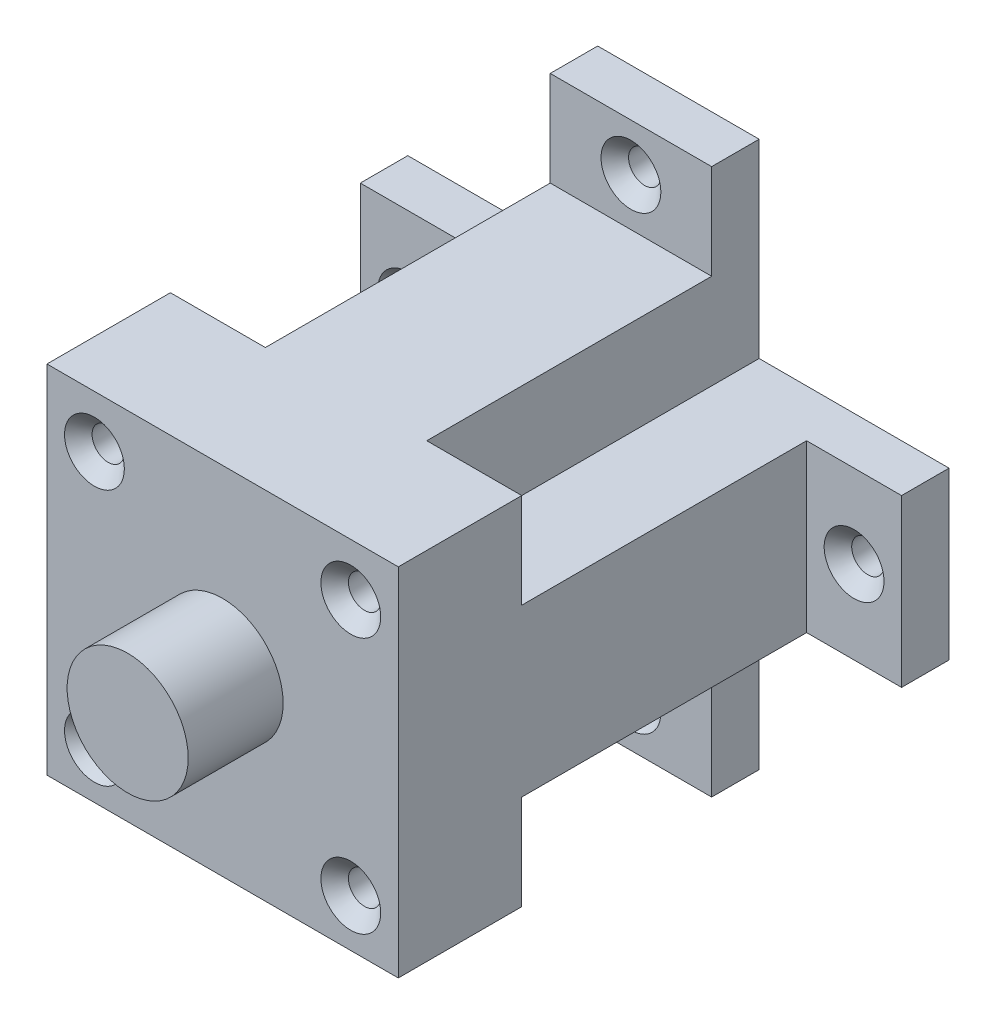
from build123d import *

# Parameters (mm, degrees)
ESQUISSE1_W                                       = 37
ESQUISSE1_H                                       = 37.5
BOSS_EXTRU_1_DEPTH                                = 48
ESQUISSE2_R                                       = 6.375
BOSS_EXTRU_2_DEPTH                                = 10
FRAISAGE_POUR_VIS_T_TE_FRAIS_E_BOMB_E_D           = 3.4
FRAISAGE_POUR_VIS_T_TE_FRAIS_E_BOMB_E_DEPTH       = 48
FRAISAGE_POUR_VIS_T_TE_FRAIS_E_BOMB_E_CSINK_D     = 6.3
FRAISAGE_POUR_VIS_T_TE_FRAIS_E_BOMB_E_CSINK_ANGLE = 90
FRAISAGE_POUR_VIS_T_TE_FRAIS_E_BOMB_E_TIP         = 1.021463052
ESQUISSE10_W                                      = 10
ESQUISSE10_H                                      = 10
ENL_V_MAT_EXTRU_1_DEPTH                           = 35
ESQUISSE11_W                                      = 17
ESQUISSE11_H                                      = 10
ESQUISSE11_W_2                                    = 10
ESQUISSE11_H_2                                    = 17.5
BOSS_EXTRU_5_DEPTH                                = 5
FRAISAGE_POUR_VIS_T_TE_FRAIS_E_BOM_2_D            = 3.4
FRAISAGE_POUR_VIS_T_TE_FRAIS_E_BOM_2_DEPTH        = 5
FRAISAGE_POUR_VIS_T_TE_FRAIS_E_BOM_2_CSINK_D      = 6.3
FRAISAGE_POUR_VIS_T_TE_FRAIS_E_BOM_2_CSINK_ANGLE  = 90
FRAISAGE_POUR_VIS_T_TE_FRAIS_E_BOM_2_TIP          = 1.021463052


with BuildPart() as part:
    # Esquisse1 → Boss.-Extru.1 (new body)
    with BuildSketch(Plane.XY):
        with Locations((18.5, 18.75)):
            Rectangle(ESQUISSE1_W, ESQUISSE1_H)
    extrude(amount=BOSS_EXTRU_1_DEPTH)

    # Esquisse2 → Boss.-Extru.2 (add)
    with BuildSketch(Plane.XY.offset(48)):
        with Locations((18.5, 19)):
            Circle(ESQUISSE2_R)
    extrude(amount=BOSS_EXTRU_2_DEPTH)

    # Fraisage pour vis _ t_te frais_e bomb_e
    with Locations(Plane.XY.offset(48)):
        with Locations((5, 32), (32, 32), (32, 5), (5, 5)):
            CounterSinkHole(FRAISAGE_POUR_VIS_T_TE_FRAIS_E_BOMB_E_D / 2, FRAISAGE_POUR_VIS_T_TE_FRAIS_E_BOMB_E_CSINK_D / 2, depth=FRAISAGE_POUR_VIS_T_TE_FRAIS_E_BOMB_E_DEPTH, counter_sink_angle=FRAISAGE_POUR_VIS_T_TE_FRAIS_E_BOMB_E_CSINK_ANGLE)
            with Locations((0, 0, -(FRAISAGE_POUR_VIS_T_TE_FRAIS_E_BOMB_E_DEPTH + FRAISAGE_POUR_VIS_T_TE_FRAIS_E_BOMB_E_TIP / 2))):  # 118° drill point
                Cone(0, FRAISAGE_POUR_VIS_T_TE_FRAIS_E_BOMB_E_D / 2, FRAISAGE_POUR_VIS_T_TE_FRAIS_E_BOMB_E_TIP, mode=Mode.SUBTRACT)

    # Esquisse10 → Enlèv. mat.-Extru.1 (cut)
    with BuildSketch(Plane(origin=(0, 0, 0), x_dir=(-1, 0, 0), z_dir=(0, 0, -1))):
        with Locations((-32, 5)):
            Rectangle(ESQUISSE10_W, ESQUISSE10_H)
        with Locations((-32, 32.5)):
            Rectangle(ESQUISSE10_W, ESQUISSE10_H)
        with Locations((-5, 32.5)):
            Rectangle(ESQUISSE10_W, ESQUISSE10_H)
        with Locations((-5, 5)):
            Rectangle(ESQUISSE10_W, ESQUISSE10_H)
    extrude(amount=-ENL_V_MAT_EXTRU_1_DEPTH, mode=Mode.SUBTRACT)

    # Esquisse11 → Boss.-Extru.5 (add)
    with BuildSketch(Plane(origin=(0, 0, 0), x_dir=(-1, 0, 0), z_dir=(0, 0, -1))):
        with Locations((-18.5, 42.5)):
            Rectangle(ESQUISSE11_W, ESQUISSE11_H)
        with Locations((-42, 18.75)):
            Rectangle(ESQUISSE11_W_2, ESQUISSE11_H_2)
        with Locations((5, 18.75)):
            Rectangle(ESQUISSE11_W_2, ESQUISSE11_H_2)
        with Locations((-18.5, -5)):
            Rectangle(ESQUISSE11_W, ESQUISSE11_H)
    extrude(amount=-BOSS_EXTRU_5_DEPTH)

    # Fraisage pour vis _ t_te frais_e bom 2
    with Locations(Plane.XY.offset(5)):
        with Locations((18.5, 42.5), (42, 18.75), (18.5, -5), (-5, 18.75)):
            CounterSinkHole(FRAISAGE_POUR_VIS_T_TE_FRAIS_E_BOM_2_D / 2, FRAISAGE_POUR_VIS_T_TE_FRAIS_E_BOM_2_CSINK_D / 2, depth=FRAISAGE_POUR_VIS_T_TE_FRAIS_E_BOM_2_DEPTH, counter_sink_angle=FRAISAGE_POUR_VIS_T_TE_FRAIS_E_BOM_2_CSINK_ANGLE)
            with Locations((0, 0, -(FRAISAGE_POUR_VIS_T_TE_FRAIS_E_BOM_2_DEPTH + FRAISAGE_POUR_VIS_T_TE_FRAIS_E_BOM_2_TIP / 2))):  # 118° drill point
                Cone(0, FRAISAGE_POUR_VIS_T_TE_FRAIS_E_BOM_2_D / 2, FRAISAGE_POUR_VIS_T_TE_FRAIS_E_BOM_2_TIP, mode=Mode.SUBTRACT)


solid = part.part
